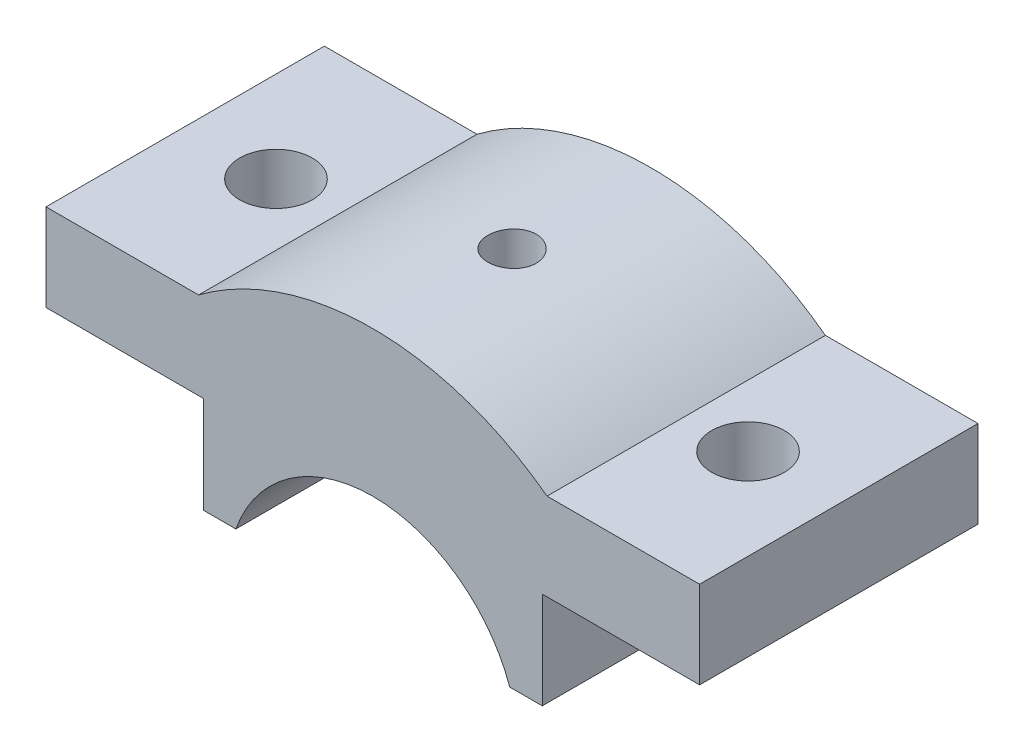
from build123d import *

# Parameters (mm, degrees)
BOSS_EXTRUDE1_DEPTH  = 23
SKETCH2_R            = 6
CUT_EXTRUDE1_DEPTH   = 67.104489714
CUT_EXTRUDE2_START   = -8.577540152
CUT_EXTRUDE2_DEPTH   = 19.577540152
CUT_EXTRUDE2_START_2 = -5
CUT_EXTRUDE2_2_DEPTH = 10


with BuildPart() as part:
    # Sketch1 → Boss-Extrude1 (new, symmetric)
    with BuildSketch(Plane.XY):
        with BuildLine():
            Line((-22.627416998, 8), (-28, 8))
            Line((-28, 8), (-28, 24))
            Line((-28, 24), (-54, 24))
            Line((-54, 24), (-54, 38.410583031))
            Line((-54, 38.410583031), (-28.785883888, 38.410583031))
            ThreePointArc((-28.785883888, 38.410583031), (0, 48), (28.785883888, 38.410583031))
            Line((28.785883888, 38.410583031), (54, 38.410583031))
            Line((54, 38.410583031), (54, 24))
            Line((54, 24), (28, 24))
            Line((28, 24), (28, 8))
            Line((28, 8), (22.627416998, 8))
            ThreePointArc((22.627416998, 8), (0, 24), (-22.627416998, 8))
        make_face()
    extrude(amount=BOSS_EXTRUDE1_DEPTH, both=True)

    # Sketch2 → Cut-Extrude1 (cut, through all)
    with BuildSketch(Plane(origin=(0, 38.410583031, 0), x_dir=(1, 0, 0), z_dir=(0, 1, 0))):
        with Locations(Location((-39, 0, 0), (0, 0, 270))):
            Circle(SKETCH2_R)
        with Locations(Location((39, 0, 0), (0, 0, 270))):
            Circle(SKETCH2_R)
    extrude(amount=-CUT_EXTRUDE1_DEPTH, mode=Mode.SUBTRACT)

    # Cut-Extrude2: read off the stored shape, not the designer's step
    # Cut-Extrude2 outline → Cut-Extrude2 (cut)
    with BuildSketch(Plane(origin=(0, 38.410583031, 0), x_dir=(1, 0, 0), z_dir=(0, 1, 0)).offset(CUT_EXTRUDE2_START)):
        with BuildLine():
            add(Edge.make_bspline(
                [(0, 4), (-1.057527997, 4), (-2.091087742, 3.565911724), (-3.566323367, 2.090385612), (-3.999433765, 1.046115956), (-4.00056506, -1.04178128), (-3.576219278, -2.07994956), (-2.083227921, -3.574310552), (-1.045821073, -3.9996204), (1.042915307, -4.000379072), (2.087446575, -3.567981834), (3.563947107, -2.094327717), (3.998968512, -1.060310778), (4.001027689, 1.052513916), (3.568016054, 2.087668509), (2.093312914, 3.564707479), (1.057527997, 4), (0, 4)],
                knots=[0, 0, 0, 0, 0.125, 0.125, 0.25, 0.25, 0.375, 0.375, 0.5, 0.5, 0.625, 0.625, 0.75, 0.75, 0.875, 0.875, 1, 1, 1, 1], degree=3))
        make_face()
    extrude(amount=CUT_EXTRUDE2_DEPTH, mode=Mode.SUBTRACT)

    # Cut-Extrude2 2 outline → Cut-Extrude2 2 (add)
    with BuildSketch(Plane.XY.offset(CUT_EXTRUDE2_START_2)):
        with BuildLine():
            ThreePointArc((4.00000004, 29.83304297), (-2.3e-08, 30), (-4.000000085, 29.833042966))
            Line((-4.000000085, 29.833042966), (4.00000004, 29.83304297))
        make_face()
    extrude(amount=CUT_EXTRUDE2_2_DEPTH)


solid = part.part
